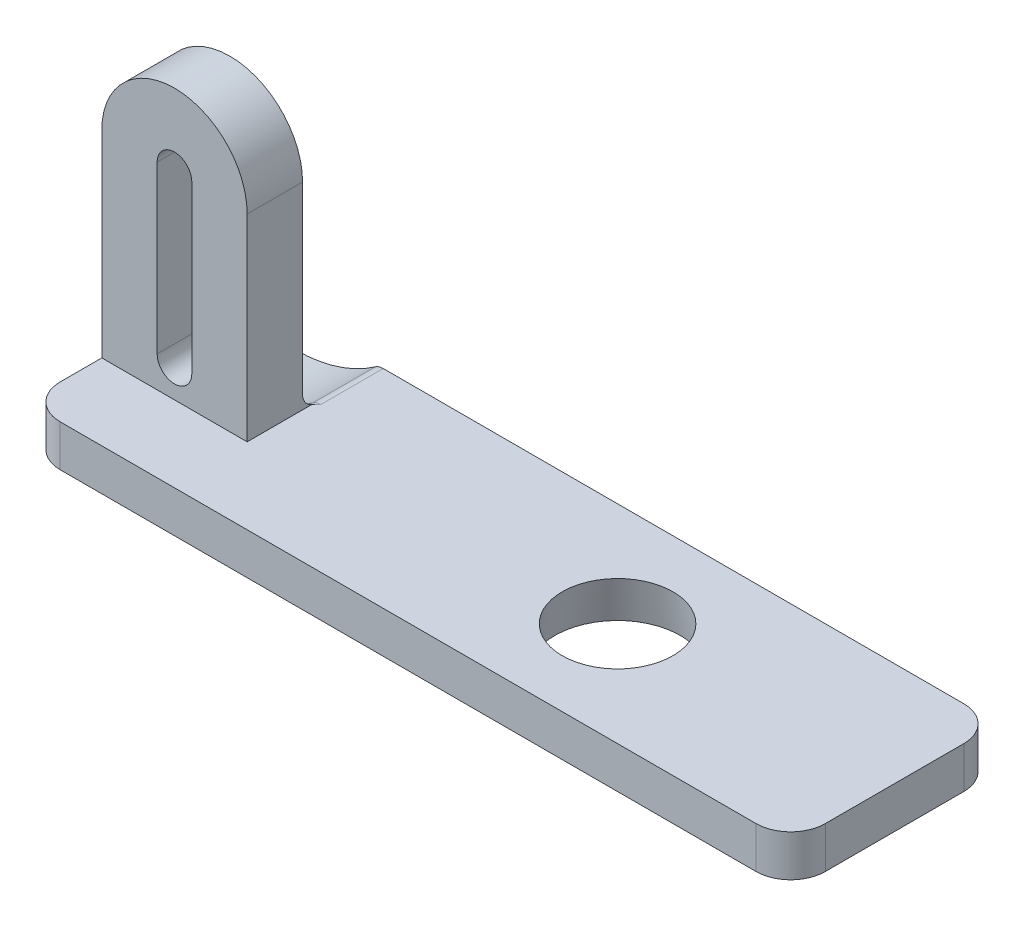
from build123d import *

# Parameters (mm, degrees)
BOSS_EXTRUDE1_DEPTH = 7.5
CUT_EXTRUDE1_DEPTH  = 5.5
CUT_EXTRUDE2_START  = -9.5
CUT_EXTRUDE2_DEPTH  = 5.5
SKETCH3_R           = 4.000000000000006
CUT_EXTRUDE3_DEPTH  = 55.1894823743501
CUT_EXTRUDE3_DRAFT  = 10.000000000000002
FILLET1_R           = 2.5
CUT_EXTRUDE4_START  = -2
CUT_EXTRUDE4_DEPTH  = 2
FILLET2_R           = 10
FILLET5_R           = 1
FILLET3_R           = 1


with BuildPart() as part:
    # Sketch1 → Boss-Extrude1 (new, symmetric)
    with BuildSketch(Plane.XY):
        with BuildLine():
            Line((-5.249999999999999, 12), (-5.249999999999999, -5.25))
            Line((-5.249999999999999, -5.25), (50, -5.25))
            Line((50, -5.25), (50, -2.2500000000000004))
            Line((50, -2.2500000000000004), (5.250000000000001, -2.2500000000000004))
            Line((5.250000000000001, -2.2500000000000004), (5.249999999999999, 12))
            ThreePointArc((5.249999999999999, 12), (3.2e-16, 17.25), (-5.249999999999999, 12))
        make_face()
        with BuildLine():
            Line((1.2499999999999998, 12), (1.2500000000000002, 0))
            ThreePointArc((1.2500000000000002, 0), (-2.3e-16, -1.2500000000000002), (-1.2500000000000002, 0))
            Line((-1.2500000000000002, 0), (-1.2499999999999998, 12))
            ThreePointArc((-1.2499999999999998, 12), (8e-17, 13.25), (1.2499999999999998, 12))
        make_face(mode=Mode.SUBTRACT)
    extrude(amount=BOSS_EXTRUDE1_DEPTH, both=True)

    # Sketch2 → Cut-Extrude1 (cut)
    with BuildSketch(Plane.XY.offset(7.5)):
        with BuildLine():
            Line((-5.249999999999999, 12), (-5.249999999999996, -2.2500000000000018))
            Line((-5.249999999999996, -2.2500000000000018), (5.250000000000001, -2.2500000000000004))
            Line((5.250000000000001, -2.2500000000000004), (5.249999999999999, 12))
            ThreePointArc((5.249999999999999, 12), (3.2e-16, 17.25), (-5.249999999999999, 12))
        make_face()
    extrude(amount=-CUT_EXTRUDE1_DEPTH, mode=Mode.SUBTRACT)

    # Sketch2<2> → Cut-Extrude2 (cut)
    with BuildSketch(Plane.XY.offset(7.5).offset(CUT_EXTRUDE2_START)):
        with BuildLine():
            Line((-5.249999999999999, 12), (-5.249999999999996, -2.2500000000000018))
            Line((-5.249999999999996, -2.2500000000000018), (5.250000000000001, -2.2500000000000004))
            Line((5.250000000000001, -2.2500000000000004), (5.249999999999999, 12))
            ThreePointArc((5.249999999999999, 12), (3.2e-16, 17.25), (-5.249999999999999, 12))
        make_face()
    extrude(amount=-CUT_EXTRUDE2_DEPTH, mode=Mode.SUBTRACT)


with BuildPart() as cut_extrude3_tool:
    # Sketch3 → Cut-Extrude3 (with draft: the straight prism first)
    with BuildSketch(Plane(origin=(0, -2.2500000000000004, 0), x_dir=(1, 0, 0), z_dir=(0, 1, 0))):
        with Locations((30, 0)):
            Circle(SKETCH3_R)
    extrude(amount=-CUT_EXTRUDE3_DEPTH)
    # Cut-Extrude3: the draft: its side faces are tilted about the plane it starts from
    cut_extrude3_sides = [cut_extrude3_tool.faces().sort_by_distance(p)[0] for p in [
        (26, -29.844741187, 0),
    ]]
    draft(cut_extrude3_sides, Plane(origin=(0, -2.2500000000000004, 0), x_dir=(1, 0, 0), z_dir=(0, 1, 0)), CUT_EXTRUDE3_DRAFT)


with BuildPart() as part_1:
    add(part.part)

    # Cut-Extrude3: cut by cut_extrude3_tool
    add(cut_extrude3_tool.part, mode=Mode.SUBTRACT)

    # Fillet1
    fillet1_edges = [part_1.edges().sort_by_distance(p)[0] for p in [
        (50, -3.75, 7.5),
        (-5.249999999999999, -3.75, 7.5),
        (-5.249999999999999, -3.75, -7.5),
        (50, -3.75, -7.5),
    ]]
    fillet(fillet1_edges, radius=FILLET1_R)

    # Sketch4 → Cut-Extrude4 (cut)
    with BuildSketch(Plane(origin=(0, -2.2500000000000004, 0), x_dir=(1, 0, 0), z_dir=(0, 1, 0)).offset(CUT_EXTRUDE4_START)):
        with BuildLine():
            Line((5.250000000000001, 2.0000000000000018), (-5.249999999999996, 2.0000000000000018))
            Line((-5.249999999999996, 2.0000000000000018), (-5.249999999999996, 4.999999999999997))
            ThreePointArc((-5.249999999999996, 4.999999999999997), (-4.517766952966367, 6.767766952966371), (-2.7499999999999956, 7.5))
            Line((-2.7499999999999956, 7.5), (5.250000000000003, 7.5))
            Line((5.250000000000003, 7.5), (5.250000000000001, 2.0000000000000018))
        make_face()
    extrude(amount=CUT_EXTRUDE4_DEPTH, mode=Mode.SUBTRACT)

    # Fillet2
    # the kernel refuses this fillet: 10 mm, written as the material it adds along each edge
    with BuildSketch(Plane(origin=(5.250000000000003, -4.25, -7.5), x_dir=(-1.168e-13, 1, 0), z_dir=(-3.2e-16, 0, 1))) as fillet2_piece_1_section:
        with BuildLine():
            CenterArc((10.0000000000007, 5.99999999999948), FILLET2_R, 179.99999999999332, 36.869897645847004)
            Line((7.0077e-13, 6.000000000000648), (0, 0))
            Line((0, 0), (2.0000000000003118, 0))
        make_face()
    fillet2_piece_1 = extrude(amount=20.500000000001616, mode=Mode.PRIVATE)
    fillet2_piece_1 = split(fillet2_piece_1, bisect_by=Plane(origin=(2.41860221548833, -3.7558066464660698, 2), z_dir=(0, 0, -1)), keep=Keep.TOP, mode=Mode.PRIVATE)
    add(fillet2_piece_1)

    # Fillet5
    fillet5_edges = [part_1.edges().sort_by_distance(p)[0] for p in [
        (5.250000000000002, -2.2500000000000004, -4.750000000000001),
    ]]
    fillet(fillet5_edges, radius=FILLET5_R)

    # Fillet3
    # the kernel refuses this fillet: 1 mm, written as the material it adds along each edge
    with BuildSketch(Plane(origin=(-0.7499999999989999, 5.750000000001, -2.0000000000000018), x_dir=(0.5749595745759393, -0.8181818181819093, 0), z_dir=(0.8181818181819093, 0.5749595745759393, 0))) as fillet3_piece_1:
        with BuildLine():
            CenterArc((10 - FILLET3_R, FILLET3_R), FILLET3_R, 270, 90)
            Line((10 - FILLET3_R, 0), (10, 0))
            Line((10, 0), (10, FILLET3_R))
        make_face()
    revolve(axis=Axis((-0.7499999999989999, 5.750000000001, -2.0000000000000018), (0, 0, -1)), revolution_arc=35.0968012275825)
    with BuildSketch(Plane(origin=(-0.7500000000006111, -4.25, -2.0000000000000018), x_dir=(0, 0, -1), z_dir=(-1, 0, 0))) as fillet3_piece_2:
        with BuildLine():
            CenterArc((FILLET3_R, -FILLET3_R), FILLET3_R, 90, 90)
            Line((0, -FILLET3_R), (0, 0))
            Line((0, 0), (FILLET3_R, 0))
        make_face()
    extrude(amount=4.4999999999993845)
    with BuildSketch(Plane(origin=(5.574555320336334, -3.250000000000001, -2.0000000000000018), x_dir=(-0.5749595745759413, 0.818181818181908, 0), z_dir=(-0.818181818181908, -0.5749595745759413, 0))) as fillet3_piece_3_section:
        with BuildLine():
            CenterArc((1.0000000000000002 + FILLET3_R, FILLET3_R), FILLET3_R, 180, 90)
            Line((1.0000000000000002 + FILLET3_R, 0), (1.0000000000000002, 0))
            Line((1.0000000000000002, 0), (1.0000000000000002, FILLET3_R))
        make_face()
    fillet3_piece_3 = revolve(axis=Axis((5.574555320336334, -3.250000000000001, -2.0000000000000018), (0, 0, -1)), revolution_arc=178.34499823253051, mode=Mode.PRIVATE)
    fillet3_piece_3 = split(fillet3_piece_3, bisect_by=Plane(origin=(5.250000000000001, -2.3158219875897332, -2.423725348187279), z_dir=(-1, -1.2e-16, 0)), keep=Keep.TOP, mode=Mode.PRIVATE)
    add(fillet3_piece_3)
    with BuildSketch(Plane(origin=(5.574555320336334, -3.250000000000001, -2.0000000000000018), x_dir=(-0.5749595745759413, 0.818181818181908, 0), z_dir=(-0.818181818181908, -0.5749595745759413, 0))) as fillet3_piece_4_section:
        with BuildLine():
            CenterArc((1.0000000000000002 + FILLET3_R, FILLET3_R), FILLET3_R, 180, 90)
            Line((1.0000000000000002 + FILLET3_R, 0), (1.0000000000000002, 0))
            Line((1.0000000000000002, 0), (1.0000000000000002, FILLET3_R))
        make_face()
    fillet3_piece_4 = revolve(axis=Axis((5.574555320336334, -3.250000000000001, -2.0000000000000018), (0, 0, -1)), revolution_arc=178.34499823253051, mode=Mode.PRIVATE)
    fillet3_piece_4 = split(fillet3_piece_4, bisect_by=Plane(origin=(5.333721819231152, -2.2500000000000004, -2.422839116405143), z_dir=(1.3e-16, -1, 0)), keep=Keep.TOP, mode=Mode.PRIVATE)
    add(fillet3_piece_4)


solid = part_1.part
